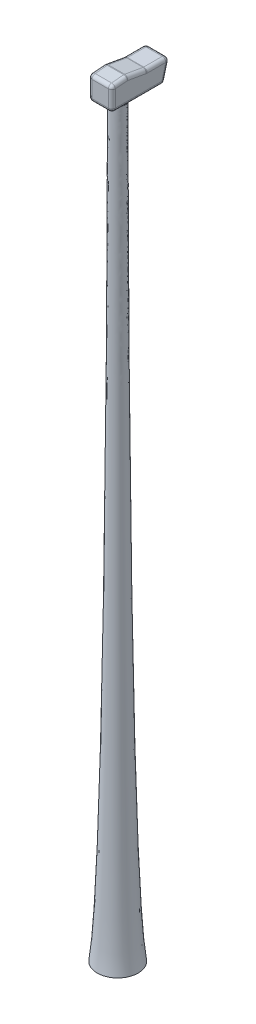
from build123d import *

# Parameters (mm, degrees)
AUFSATZ_LINEAR_AUSTRAGEN1_DEPTH      = 1000
AUFSATZ_LINEAR_AUSTRAGEN1_DEPTH_BACK = 1000
VERRUNDUNG1_R                        = 300


with BuildPart() as part:
    # Skizze2 → Aufsatz-Linear austragen1 (new, two sides: drawn at the far end of the back side and taken through both)
    with BuildSketch(Plane(origin=(0, 0, 0), x_dir=(0, 0, -1), z_dir=(1, 0, 0)).offset(-AUFSATZ_LINEAR_AUSTRAGEN1_DEPTH_BACK)):
        Polygon((500, -1000), (500, 1000), (1850, 1118.10969576), (3500, 827.170177591), (5500, 827.170177591), (5010.41122648, -1000), align=None)
    extrude(amount=AUFSATZ_LINEAR_AUSTRAGEN1_DEPTH + AUFSATZ_LINEAR_AUSTRAGEN1_DEPTH_BACK)

    # Verrundung1
    verrundung1_edges = [part.edges().sort_by_distance(p)[0] for p in [
        (-1000, 827.170177591, -4500),
        (0, 827.170177591, -5500),
        (1000, 827.170177591, -4500),
        (-1000, 972.639936676, -2675),
        (0, 827.170177591, -3500),
        (1000, 972.639936676, -2675),
        (-1000, 1059.05484788, -1175),
        (0, 1118.10969576, -1850),
        (1000, 1059.05484788, -1175),
        (0, 1000, -500),
        (0, -1000, -500),
        (-1000, 0, -500),
        (-1000, -1000, -2755.20561324),
        (-1000, -86.414911204, -5255.20561324),
        (0, -1000, -5010.41122648),
        (1000, -86.414911204, -5255.20561324),
        (1000, -1000, -2755.20561324),
        (1000, 0, -500),
    ]]
    fillet(verrundung1_edges, radius=VERRUNDUNG1_R)

    # Skizze3 → Rotation1 (revolve)
    with BuildSketch(Plane(origin=(0, 0, 0), x_dir=(0, 0, -1), z_dir=(1, 0, 0))):
        with BuildLine():
            Line((1300, -700), (2000, -700))
            Line((2000, -700), (2000, -65000))
            Line((2000, -65000), (250, -65000))
            add(Edge.make_bspline(
                [(1375, -1200), (1375, -2032.504803687), (1337.287697599, -57815.760038017), (250, -65000)],
                knots=[0, 0, 0, 0, 1, 1, 1, 1], degree=3))
            Line((1375, -1200), (1375, -1000))
            Line((1375, -1000), (1350, -1000))
            Line((1350, -1000), (1350, -1200))
            Line((1350, -1200), (1300, -1200))
            Line((1300, -1200), (1300, -700))
        make_face()
    revolve(axis=Axis((0, 0, -2000), (0, -1, 0)))


solid = part.part
